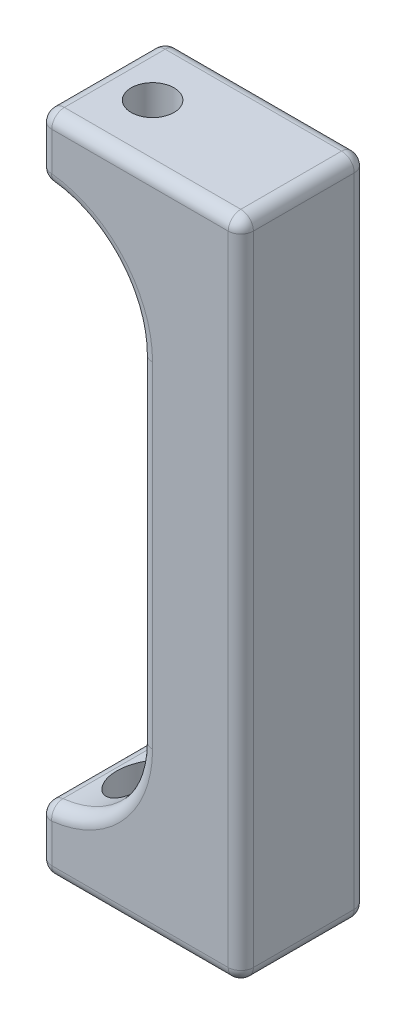
from build123d import *

# Parameters (mm, degrees)
SKETCH1_W               = 8
SKETCH1_H               = 5
SKETCH1_H_2             = 52.6
BOSS_EXTRUDE1_DEPTH     = 10
SKETCH2_R               = 1.7
CUT_EXTRUDE1_DEPTH      = 55.870392745
CUT_EXTRUDE2_DEPTH      = 40
CUT_EXTRUDE2_DEPTH_BACK = 2.5
SKETCH3_R               = 2.85
FILLET1_DEPTH           = 2.1499999
FILLET1_START           = 7.8500001
FILLET1_2_DEPTH         = 2.1499999
FILLET1_START_2         = 0.9438
FILLET1_3_DEPTH         = 2.356451924
FILLET1_START_3         = 6.7000001
FILLET1_4_DEPTH         = 2.2437999
FILLET1_START_4         = 2.1499999
FILLET1_5_DEPTH         = 5.7000002
FILLET1_6_OUTLINE_W     = 1.7
FILLET1_6_OUTLINE_H     = 2.386959423
FILLET1_6_OUTLINE_W_2   = 2.85
FILLET1_6_OUTLINE_H_2   = 3.868292879
FILLET2_R               = 1


with BuildPart() as part:
    # Sketch1 → Boss-Extrude1 (new body)
    with BuildSketch(Plane.XY):
        with Locations((-8, 23.8)):
            Rectangle(SKETCH1_W, SKETCH1_H)
        Rectangle(SKETCH1_W, SKETCH1_H_2)
        with Locations((-8, -23.8)):
            Rectangle(SKETCH1_W, SKETCH1_H)
    extrude(amount=BOSS_EXTRUDE1_DEPTH)

    # Sketch2 → Cut-Extrude1 (cut, through all)
    with BuildSketch(Plane(origin=(0, 26.3, 0), x_dir=(1, 0, 0), z_dir=(0, 1, 0))):
        with Locations(Location((-8, -5, 0), (0, 0, 270))):
            Circle(SKETCH2_R)
    extrude(amount=-CUT_EXTRUDE1_DEPTH, mode=Mode.SUBTRACT)

    # Sketch3 → Cut-Extrude2 (cut, two sides: drawn at the far end of the back side and taken through both)
    with BuildSketch(Plane(origin=(0, -21.3, 0), x_dir=(1, 0, 0), z_dir=(0, 1, 0)).offset(-CUT_EXTRUDE2_DEPTH_BACK)):
        with Locations((-8, -5)):
            Circle(SKETCH3_R)
    extrude(amount=CUT_EXTRUDE2_DEPTH + CUT_EXTRUDE2_DEPTH_BACK, mode=Mode.SUBTRACT)

    # Fillet1: read off the stored shape, not the designer's step
    # Fillet1 outline → Fillet1 (add)
    with BuildSketch(Plane.XY):
        with BuildLine():
            ThreePointArc((-12, 21.3), (-6.343145751, 18.956854249), (-4, 13.3))
            Line((-4, 13.3), (-4, 21.3))
            Line((-4, 21.3), (-12, 21.3))
        make_face()
        with BuildLine():
            Line((-4, -21.3), (-4, -13.3))
            ThreePointArc((-4, -13.3), (-6.343145751, -18.956854249), (-12, -21.3))
            Line((-12, -21.3), (-4, -21.3))
        make_face()
    extrude(amount=FILLET1_DEPTH)

    # Fillet1 2 outline → Fillet1 2 (add)
    with BuildSketch(Plane.XY.offset(FILLET1_START)):
        with BuildLine():
            ThreePointArc((-12, 21.3), (-6.343145751, 18.956854249), (-4, 13.3))
            Line((-4, 13.3), (-4, 21.3))
            Line((-4, 21.3), (-12, 21.3))
        make_face()
        with BuildLine():
            Line((-4, -21.3), (-4, -13.3))
            ThreePointArc((-4, -13.3), (-6.343145751, -18.956854249), (-12, -21.3))
            Line((-12, -21.3), (-4, -21.3))
        make_face()
    extrude(amount=FILLET1_2_DEPTH)

    # Fillet1 3 outline → Fillet1 3 (add)
    with BuildSketch(Plane.XY.offset(FILLET1_START_2)):
        with BuildLine():
            ThreePointArc((-12, 21.3), (-6.343145751, 18.956854249), (-4, 13.3))
            Line((-4, 13.3), (-4, 21.3))
            Line((-4, 21.3), (-12, 21.3))
        make_face()
    extrude(amount=FILLET1_3_DEPTH)

    # Fillet1 4 outline → Fillet1 4 (add)
    with BuildSketch(Plane.XY.offset(FILLET1_START_3)):
        with BuildLine():
            ThreePointArc((-12, 21.3), (-6.343145751, 18.956854249), (-4, 13.3))
            Line((-4, 13.3), (-4, 21.3))
            Line((-4, 21.3), (-12, 21.3))
        make_face()
    extrude(amount=FILLET1_4_DEPTH)

    # Fillet1 5 outline → Fillet1 5 (add)
    with BuildSketch(Plane.XY.offset(FILLET1_START_4)):
        with BuildLine():
            ThreePointArc((-12, 21.3), (-6.343145751, 18.956854249), (-4, 13.3))
            Line((-4, 13.3), (-4, 21.3))
            Line((-4, 21.3), (-12, 21.3))
        make_face()
        with BuildLine():
            Line((-4, -21.3), (-4, -13.3))
            ThreePointArc((-4, -13.3), (-6.343145751, -18.956854249), (-12, -21.3))
            Line((-12, -21.3), (-4, -21.3))
        make_face()
    extrude(amount=FILLET1_5_DEPTH)

    # Fillet1 6 outline → Fillet1 6 (revolve, cut)
    with BuildSketch(Plane(origin=(-8, 0, 5), x_dir=(1, 0, 0), z_dir=(0, 0, 1))):
        with Locations((0.85, 20.106520289)):
            Rectangle(FILLET1_6_OUTLINE_W, FILLET1_6_OUTLINE_H)
        with Locations((1.425, -19.36585356)):
            Rectangle(FILLET1_6_OUTLINE_W_2, FILLET1_6_OUTLINE_H_2)
    revolve(axis=Axis((-8, 0, 5), (0, 1, 0)), mode=Mode.SUBTRACT)

    # Fillet2
    fillet2_edges = [part.edges().sort_by_distance(p)[0] for p in [
        (4, 0, 0),
        (-4, -26.3, 0),
        (-12, -23.8, 0),
        (-12, 23.8, 10),
        (-12, 23.8, 0),
        (-4, 26.3, 0),
        (4, 26.3, 5),
        (4, -26.3, 5),
        (-12, -26.3, 5),
        (-12, -21.3, 5),
        (-12, 21.3, 5),
        (-12, 26.3, 5),
        (-12, -23.8, 10),
        (-4, -26.3, 10),
        (4, 0, 10),
        (-4, 0, 0),
        (-4, 0, 10),
        (-6.343145751, 18.956854249, 0),
        (-4, 26.3, 10),
        (-6.343145751, 18.956854249, 10),
        (-6.343145751, -18.956854249, 0),
        (-6.343145751, -18.956854249, 10),
    ]]
    fillet(fillet2_edges, radius=FILLET2_R)


solid = part.part
